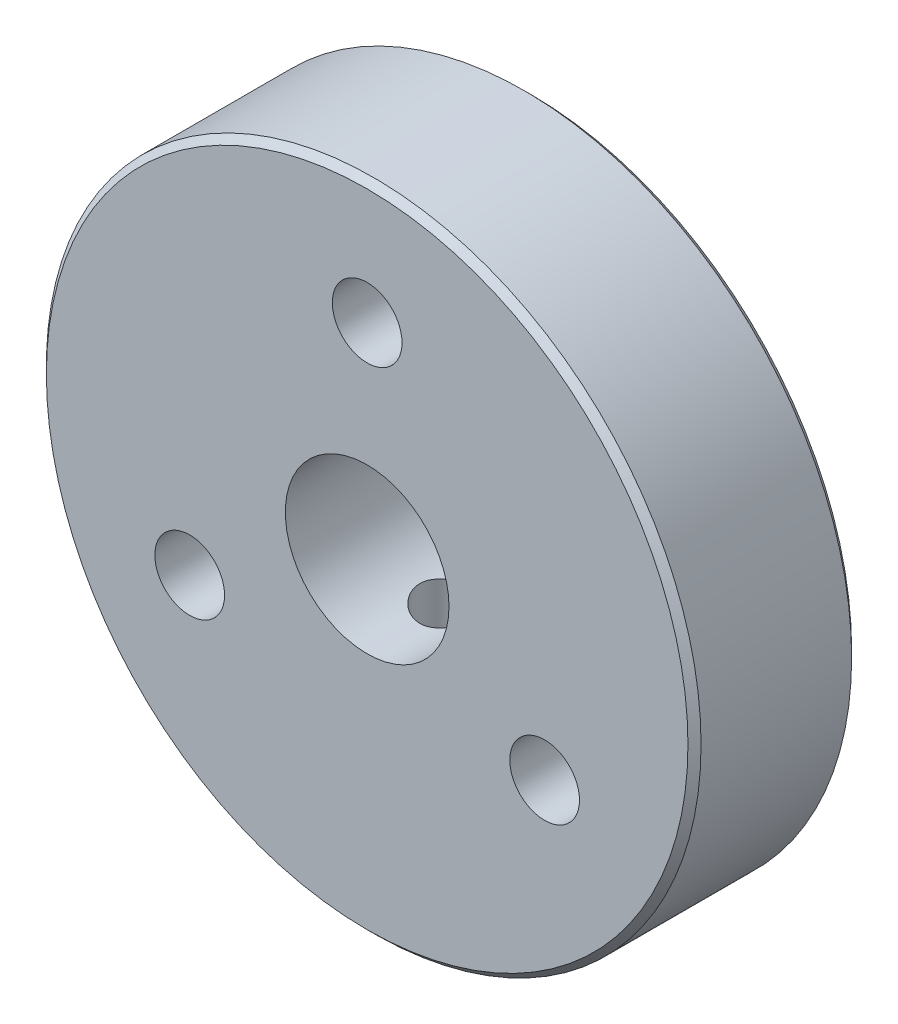
from build123d import *

# Parameters (mm, degrees)
SKETCH2_R             = 12.7
SKETCH2_R_2           = 3.175
BOSS_EXTRUDE1_DEPTH   = 3.175
CHAMFER1_SIZE         = 0.254
F_6_32_TAPPED_HOLE1_D = 2.7051


# Read off the part's stored shape, not the designer's step: #4-40 Tapped Hole2
with BuildPart() as part:
    # Sketch2 → Boss-Extrude1 (new, symmetric)
    with BuildSketch(Plane.XY):
        Circle(SKETCH2_R)
        Circle(SKETCH2_R_2, mode=Mode.SUBTRACT)
    extrude(amount=BOSS_EXTRUDE1_DEPTH, both=True)

    # Chamfer1
    chamfer1_edges = [part.edges().sort_by_distance(p)[0] for p in [
        (-12.7, 0, -3.175),
        (-12.7, 0, 3.175),
    ]]
    chamfer(chamfer1_edges, length=CHAMFER1_SIZE)

    # #6-32 Tapped Hole1 (through all)
    with Locations(Plane.XY.offset(3.175)):
        with Locations((0, 7.9502), (6.885075165, -3.9751), (-6.885075165, -3.9751)):
            Hole(F_6_32_TAPPED_HOLE1_D / 2)

    # #4-40 Tapped Hole2 outline → #4-40 Tapped Hole2 (revolve, cut)
    with BuildSketch(Plane.XY):
        Polygon((0, -12.700018831), (1.473216369, -12.700018831), (1.1303, -12.305538673), (1.1303, -2.966966147), (0, -2.966966147), align=None)
    revolve(axis=Axis((0, 0, 0), (0, 1, 0)), mode=Mode.SUBTRACT)


solid = part.part
